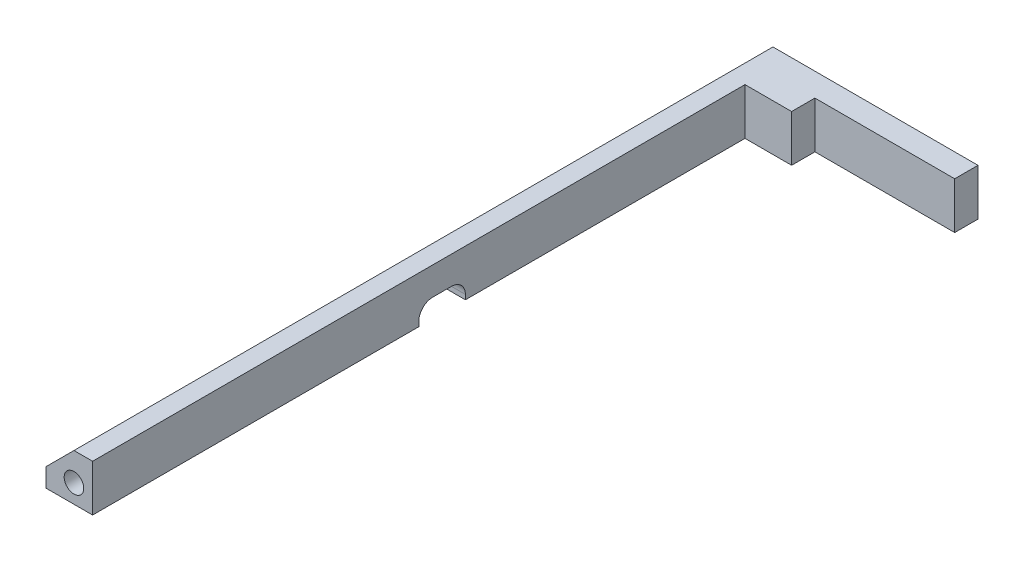
from build123d import *

# Parameters (mm, degrees)
DODANIE_WYCI_GNI_CIE1_DEPTH = 10
SZKIC2_R                    = 2.1
WYTNIJ_WYCI_GNI_CIE1_DEPTH  = 4
SZKIC3_R                    = 2.1
WYTNIJ_WYCI_GNI_CIE2_DEPTH  = 4
SFAZOWANIE1_SIZE            = 6
SZKIC4_W                    = 10
SZKIC4_H                    = 10
WYTNIJ_WYCI_GNI_CIE3_DEPTH  = 4
ZAOKR_GLENIE1_R             = 3


with BuildPart() as part:
    # Szkic1 → Dodanie-wyciągnięcie1 (new body)
    with BuildSketch(Plane(origin=(0, 0, 0), x_dir=(1, 0, 0), z_dir=(0, 1, 0))):
        Polygon((0, 0), (0, 150), (50, 150), (50, 145), (20, 145), (20, 140), (10, 140), (10, 0), align=None)
    extrude(amount=DODANIE_WYCI_GNI_CIE1_DEPTH)

    # Szkic2 → Wytnij-wyciągnięcie1 (cut)
    with BuildSketch(Plane.XZ):
        with Locations((7.2, -27)):
            Circle(SZKIC2_R)
        with Locations((7.2, -123)):
            Circle(SZKIC2_R)
    extrude(amount=-WYTNIJ_WYCI_GNI_CIE1_DEPTH, mode=Mode.SUBTRACT)

    # Szkic3 → Wytnij-wyciągnięcie2 (cut)
    with BuildSketch(Plane.XY):
        with Locations((6, 4)):
            Circle(SZKIC3_R)
    extrude(amount=-WYTNIJ_WYCI_GNI_CIE2_DEPTH, mode=Mode.SUBTRACT)

    # Sfazowanie1
    sfazowanie1_edges = [part.edges().sort_by_distance(p)[0] for p in [
        (0, 10, -75),
    ]]
    chamfer(sfazowanie1_edges, length=SFAZOWANIE1_SIZE)

    # Szkic4 → Wytnij-wyciągnięcie3 (cut)
    with BuildSketch(Plane.XZ):
        with Locations((5, -75)):
            Rectangle(SZKIC4_W, SZKIC4_H)
    extrude(amount=-WYTNIJ_WYCI_GNI_CIE3_DEPTH, mode=Mode.SUBTRACT)

    # Zaokrąglenie1
    zaokr_glenie1_edges = [part.edges().sort_by_distance(p)[0] for p in [
        (5, 4, -70),
        (5, 4, -80),
    ]]
    fillet(zaokr_glenie1_edges, radius=ZAOKR_GLENIE1_R)


solid = part.part
